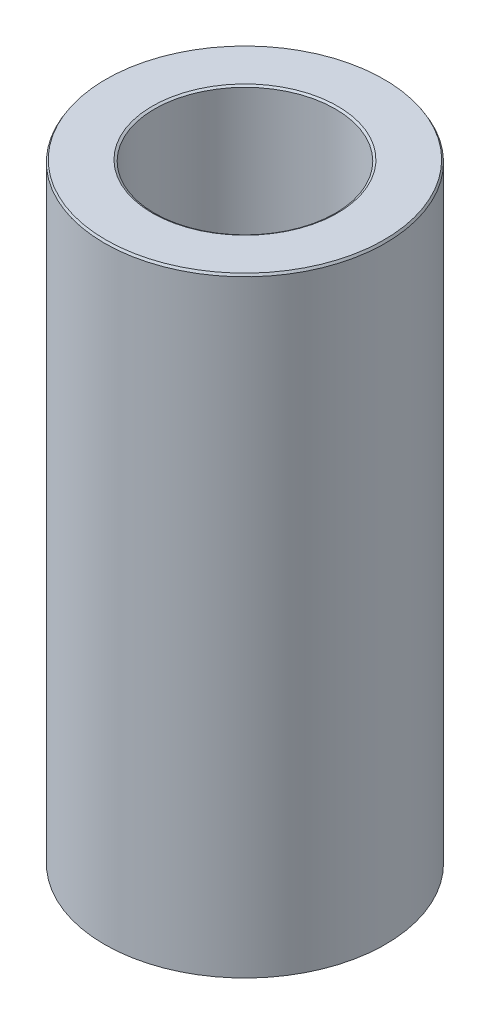
from build123d import *
from OCP.BRepFilletAPI import BRepFilletAPI_MakeChamfer

# Parameters (mm, degrees)
SKETCH1_R           = 42.5
BOSS_EXTRUDE1_DEPTH = 184.862090406
SKETCH2_R           = 27.358746791
CUT_EXTRUDE1_DEPTH  = 195.387480228
CHAMFER1_SIZE       = 0.676164275
CHAMFER1_SIZE2      = 0.404518876


with BuildPart() as part:
    # Sketch1 → Boss-Extrude1 (new body)
    with BuildSketch(Plane(origin=(0, 0, 0), x_dir=(1, 0, 0), z_dir=(0, 1, 0))):
        Circle(SKETCH1_R)
    extrude(amount=BOSS_EXTRUDE1_DEPTH)

    # Sketch2 → Cut-Extrude1 (cut, through all)
    with BuildSketch(Plane(origin=(0, 0, 0), x_dir=(1, 0, 0), z_dir=(0, 1, 0))):
        Circle(SKETCH2_R)
    extrude(amount=CUT_EXTRUDE1_DEPTH, mode=Mode.SUBTRACT)

    # Chamfer1: one chamfer whose edges measure the first distance from different faces: ONE call of the kernel's chamfer builder (chamfer() names one face for all edges)
    chamfer1_edges_1 = [part.edges().sort_by_distance(p)[0] for p in [
        (-27.358746791, 184.862090406, 0),
    ]]
    chamfer1_side_1 = [part.faces().sort_by_distance(p)[0] for p in [
        (-41.297918472, 184.862090406, 0),
    ]]
    chamfer1_edges_2 = [part.edges().sort_by_distance(p)[0] for p in [
        (-27.358746791, 0, 0),
    ]]
    chamfer1_side_2 = [part.faces().sort_by_distance(p)[0] for p in [
        (-27.358746791, 92.431045203, 0),
    ]]
    chamfer1_edges_3 = [part.edges().sort_by_distance(p)[0] for p in [
        (-42.5, 0, 0),
    ]]
    chamfer1_side_3 = [part.faces().sort_by_distance(p)[0] for p in [
        (-41.297918472, 0, 0),
    ]]
    chamfer1_edges_4 = [part.edges().sort_by_distance(p)[0] for p in [
        (-42.5, 184.862090406, 0),
    ]]
    chamfer1_side_4 = [part.faces().sort_by_distance(p)[0] for p in [
        (-42.5, 92.431045203, 0),
    ]]
    chamfer1 = BRepFilletAPI_MakeChamfer(part.part.solid().wrapped)
    for e in chamfer1_edges_1:
        chamfer1.Add(CHAMFER1_SIZE, CHAMFER1_SIZE2, e.wrapped, chamfer1_side_1[0].wrapped)  # the first distance lies on this face
    for e in chamfer1_edges_2:
        chamfer1.Add(CHAMFER1_SIZE, CHAMFER1_SIZE2, e.wrapped, chamfer1_side_2[0].wrapped)  # the first distance lies on this face
    for e in chamfer1_edges_3:
        chamfer1.Add(CHAMFER1_SIZE, CHAMFER1_SIZE2, e.wrapped, chamfer1_side_3[0].wrapped)  # the first distance lies on this face
    for e in chamfer1_edges_4:
        chamfer1.Add(CHAMFER1_SIZE, CHAMFER1_SIZE2, e.wrapped, chamfer1_side_4[0].wrapped)  # the first distance lies on this face
    add(Compound.cast(chamfer1.Shape()), mode=Mode.REPLACE)


solid = part.part
